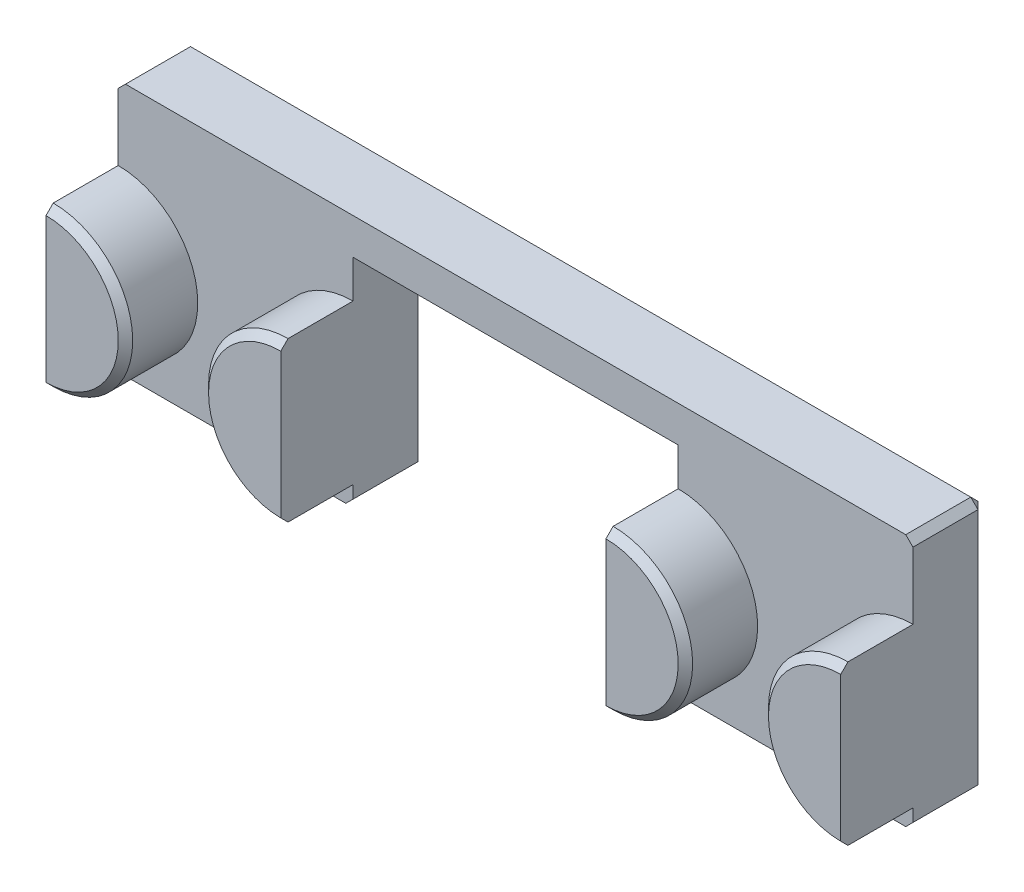
from build123d import *

# Parameters (mm, degrees)
BOSS_EXTRUDE1_DEPTH  = 2
BOSS_EXTRUDE2_DEPTH  = 2
MIRROR2_COPY_1_DEPTH = 2
MIRROR2_COPY_2_DEPTH = 2
DEBURS_SIZE          = 0.2


with BuildPart() as part:
    # Sketch1 → Boss-Extrude1 (new body)
    with BuildSketch(Plane.XY):
        Polygon((-11, 3.5), (11, 3.5), (11, -3.5), (4.5, -3.5), (4.5, 2.5), (-4.5, 2.5), (-4.5, -3.5), (-11, -3.5), align=None)
    extrude(amount=-BOSS_EXTRUDE1_DEPTH)

    # Sketch2 → Boss-Extrude2 (add)
    with BuildSketch(Plane.XY):
        with BuildLine():
            Line((11, -2.95), (11, 1.45))
            ThreePointArc((11, 1.45), (8.8, -0.75), (11, -2.95))
        make_face()
    boss_extrude2 = extrude(amount=BOSS_EXTRUDE2_DEPTH)

    # Mirror1: Boss-Extrude2 across plane
    add(boss_extrude2.mirror(Plane(origin=(7.75, 0, 0), x_dir=(0, 0, 1), z_dir=(1, 0, 0))))

    # Mirror2 copy 1 sketch → Mirror2 copy 1 (add)
    with BuildSketch(Plane(origin=(-15.5, 0, 0), x_dir=(1, 0, 0), z_dir=(0, 0, 1))):
        with BuildLine():
            Line((11, -2.95), (11, 1.45))
            ThreePointArc((11, 1.45), (8.8, -0.75), (11, -2.95))
        make_face()
    extrude(amount=MIRROR2_COPY_1_DEPTH)

    # Mirror2 copy 2 sketch → Mirror2 copy 2 (add)
    with BuildSketch(Plane(origin=(0, 0, 0), x_dir=(-1, 0, 0), z_dir=(0, 0, 1))):
        with BuildLine():
            Line((11, 2.95), (11, -1.45))
            ThreePointArc((11, -1.45), (8.8, 0.75), (11, 2.95))
        make_face()
    extrude(amount=MIRROR2_COPY_2_DEPTH)

    # Deburs
    deburs_edges = [part.edges().sort_by_distance(p)[0] for p in [
        (0, 3.5, -2),
        (11, 3.5, -1),
        (11, 0, -2),
        (11, -3.5, -1),
        (7.75, -3.5, -2),
        (4.5, -3.5, -1),
        (4.5, -0.5, -2),
        (0, 2.5, -2),
        (-4.5, -0.5, -2),
        (-4.5, -3.5, -1),
        (-7.75, -3.5, -2),
        (-11, 3.5, -1),
        (-11, 0, -2),
        (-11, -3.5, -1),
        (8.8, -0.75, 2),
        (6.7, -0.75, 2),
        (-6.7, -0.75, 2),
        (-8.8, -0.75, 2),
    ]]
    chamfer(deburs_edges, length=DEBURS_SIZE)


solid = part.part
